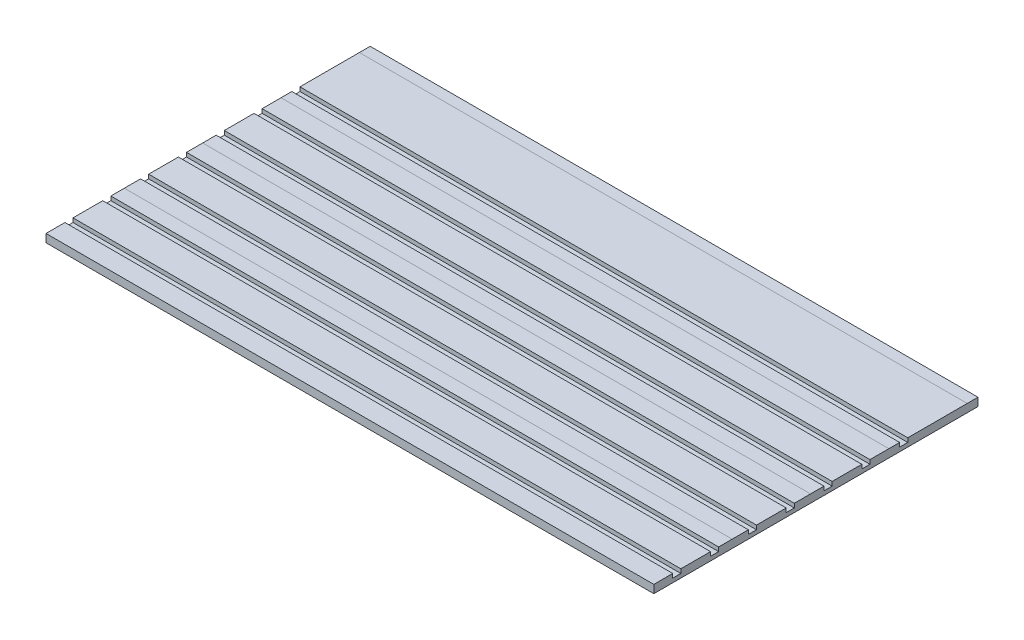
from build123d import *

# Parameters (mm, degrees)
SKETCH1_W          = 1428.75
SKETCH1_H          = 762
BOARD_DEPTH        = 19.05
SKETCH9_W          = 19.05
SKETCH9_H          = 9.525
CUT_EXTRUDE1_DEPTH = 1479.800346565
LPATTERN1_COUNT    = 7
LPATTERN1_PITCH    = 88.9


with BuildPart() as part:
    # Sketch1 → Board (new body)
    with BuildSketch(Plane(origin=(0, 0, 0), x_dir=(1, 0, 0), z_dir=(0, 1, 0))):
        Rectangle(SKETCH1_W, SKETCH1_H)
    extrude(amount=BOARD_DEPTH)

    # Sketch9 → Cut-Extrude1 (cut, through all)
    with BuildSketch(Plane.ZY.offset(714.375)):
        with Locations((327.025, 14.2875)):
            Rectangle(SKETCH9_W, SKETCH9_H)
    cut_extrude1 = extrude(amount=-CUT_EXTRUDE1_DEPTH, mode=Mode.SUBTRACT)

    # LPattern1: Cut-Extrude1 ×7
    with Locations(*[(0, 0, -i * LPATTERN1_PITCH) for i in range(1, LPATTERN1_COUNT)]):
        add(cut_extrude1, mode=Mode.SUBTRACT)


solid = part.part
